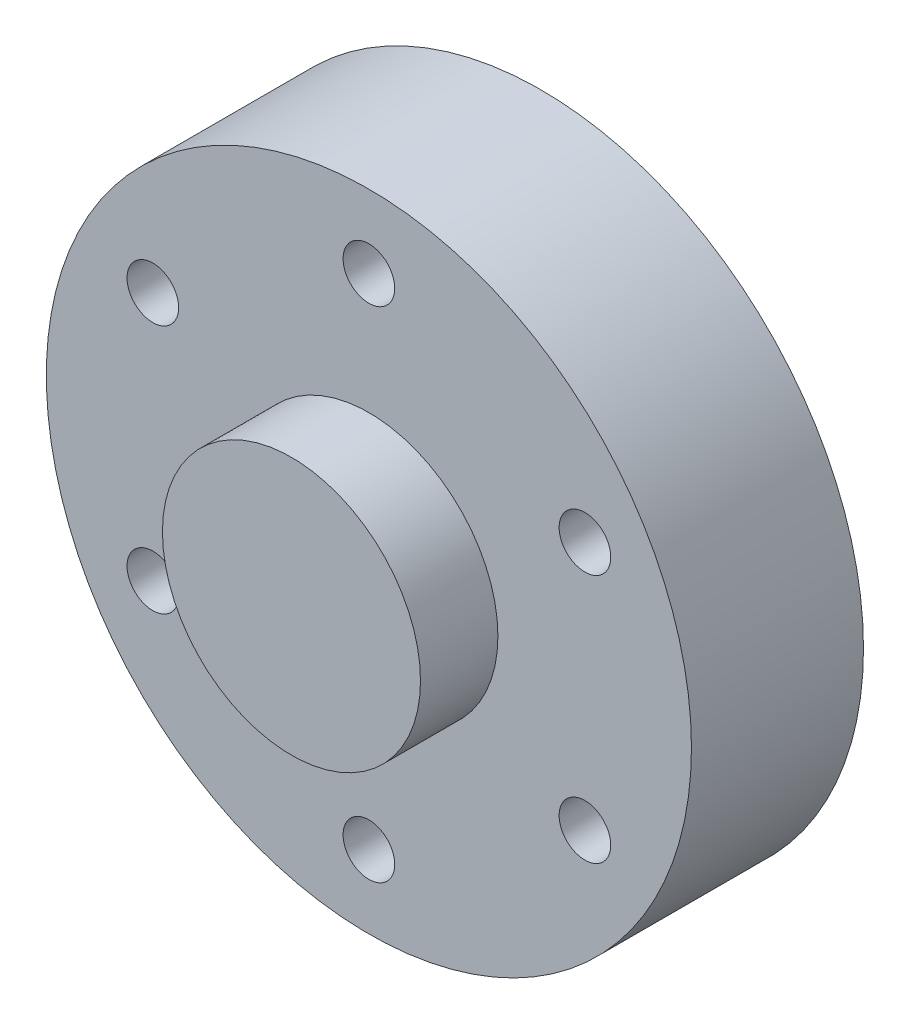
from build123d import *

# Parameters (mm, degrees)
SKETCH2_R           = 18.75
SKETCH2_R_2         = 1.5
BOSS_EXTRUDE1_DEPTH = 10
SKETCH3_R           = 7.5
BOSS_EXTRUDE2_DEPTH = 4.5
BOSS_EXTRUDE4_START = 4.5
SKETCH6_R           = 7.5
BOSS_EXTRUDE4_DEPTH = 4.5
SKETCH7_R           = 2
BOSS_EXTRUDE5_DEPTH = 1
FILLET2_R           = 0.05
CUT_EXTRUDE1_DEPTH  = 11


with BuildPart() as part:
    # Sketch2 → Boss-Extrude1 (new body)
    with BuildSketch(Plane.XY):
        Circle(SKETCH2_R)
        with Locations((0, -14.5)):
            Circle(SKETCH2_R_2, mode=Mode.SUBTRACT)
        with Locations((-12.557368355, -7.25)):
            Circle(SKETCH2_R_2, mode=Mode.SUBTRACT)
        with Locations((12.557368355, -7.25)):
            Circle(SKETCH2_R_2, mode=Mode.SUBTRACT)
        with Locations((-12.557368355, 7.25)):
            Circle(SKETCH2_R_2, mode=Mode.SUBTRACT)
        with Locations((0, 14.5)):
            Circle(SKETCH2_R_2, mode=Mode.SUBTRACT)
        with Locations((12.557368355, 7.25)):
            Circle(SKETCH2_R_2, mode=Mode.SUBTRACT)
    extrude(amount=BOSS_EXTRUDE1_DEPTH)

    # Sketch3 → Boss-Extrude2 (add)
    with BuildSketch(Plane.XY.offset(10)):
        Circle(SKETCH3_R)
    extrude(amount=BOSS_EXTRUDE2_DEPTH)

    # Sketch6 → Boss-Extrude4 (add)
    with BuildSketch(Plane(origin=(0, 0, 0), x_dir=(-1, 0, 0), z_dir=(0, 0, -1)).offset(BOSS_EXTRUDE4_START)):
        Circle(SKETCH6_R)
    extrude(amount=-BOSS_EXTRUDE4_DEPTH)

    # Sketch7 → Boss-Extrude5 (add)
    with BuildSketch(Plane(origin=(0, 0, -4.5), x_dir=(-1, 0, 0), z_dir=(0, 0, -1))):
        Circle(SKETCH7_R)
    extrude(amount=BOSS_EXTRUDE5_DEPTH)

    # Fillet2
    fillet2_edges = [part.edges().sort_by_distance(p)[0] for p in [
        (2, 0, -5.5),
    ]]
    fillet(fillet2_edges, radius=FILLET2_R)

    # Sketch9 → Cut-Extrude1 (cut)
    with BuildSketch(Plane(origin=(0, 0, -5.5), x_dir=(-1, 0, 0), z_dir=(0, 0, -1))):
        with BuildLine():
            Line((-1.204159458, 1.2), (1.204159458, 1.2))
            ThreePointArc((1.204159458, 1.2), (0, -1.7), (-1.204159458, 1.2))
        make_face()
    extrude(amount=-CUT_EXTRUDE1_DEPTH, mode=Mode.SUBTRACT)


solid = part.part
